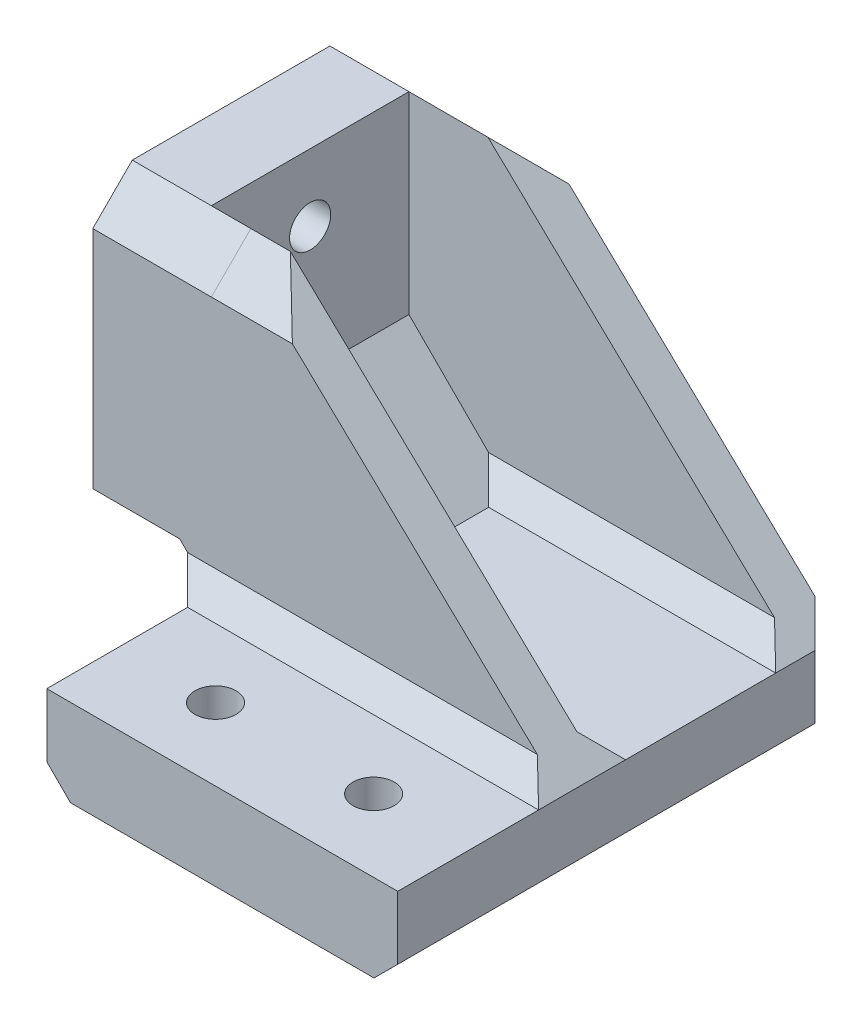
from build123d import *

# Parameters (mm, degrees)
SKETCH2_W                = 44.4
SKETCH2_H                = 55.82
BOSS_EXTRUDE1_DEPTH      = 11
CHAMFER1_SIZE            = 3
SKETCH3_R                = 2.6
CUT_EXTRUDE1_DEPTH       = 62.071371362
SKETCH4_W                = 35
SKETCH4_H                = 37.5
SKETCH4_R                = 2.6
BOSS_EXTRUDE2_DEPTH      = 5
BOSS_EXTRUDE7_DEPTH      = 5
BOSS_EXTRUDE9_DEPTH      = 5
CHAMFER8_SIZE            = 5
BOSS_EXTRUDE11_OUTLINE_W = 35
BOSS_EXTRUDE11_OUTLINE_H = 33.5
BOSS_EXTRUDE11_OUTLINE_R = 2.6
BOSS_EXTRUDE11_DEPTH     = 15
CHAMFER10_SIZE           = 5
SKETCH13_W               = 25
SKETCH13_H               = 34.5
CUT_EXTRUDE2_DEPTH       = 10
BOSS_EXTRUDE12_REACH     = 72.435
BOSS_EXTRUDE13_DEPTH     = 25
CHAMFER11_SIZE           = 3


# Read off the part's stored shape, not the designer's step: Boss-Extrude11
# Some blends are built 0.0001 mm under size
with BuildPart() as part:
    # Sketch2 → Boss-Extrude1 (new body)
    with BuildSketch(Plane(origin=(0, 0, 0), x_dir=(1, 0, 0), z_dir=(0, 1, 0))):
        with Locations((0, 27.91)):
            Rectangle(SKETCH2_W, SKETCH2_H)
    extrude(amount=BOSS_EXTRUDE1_DEPTH)

    # Chamfer1
    chamfer1_edges = [part.edges().sort_by_distance(p)[0] for p in [
        (22.2, 0, -27.91),
        (-22.2, 0, -27.91),
    ]]
    chamfer(chamfer1_edges, length=CHAMFER1_SIZE)

    # Sketch3 → Cut-Extrude1 (cut, through all)
    with BuildSketch(Plane(origin=(0, 11, 0), x_dir=(1, 0, 0), z_dir=(0, 1, 0))):
        with Locations(Location((10, 9.15, 0), (0, 0, 270))):
            Circle(SKETCH3_R)
        with Locations(Location((-10, 9.15, 0), (0, 0, 270))):
            Circle(SKETCH3_R)
    extrude(amount=-CUT_EXTRUDE1_DEPTH, mode=Mode.SUBTRACT)

    # Sketch4 → Boss-Extrude2 (add)
    with BuildSketch(Plane.ZY.offset(22.2)):
        with Locations((-38.32, 29.75)):
            Rectangle(SKETCH4_W, SKETCH4_H)
        with Locations((-38.32, 40)):
            Circle(SKETCH4_R, mode=Mode.SUBTRACT)
    extrude(amount=-BOSS_EXTRUDE2_DEPTH)

    # Sketch8 → Boss-Extrude7 (add)
    with BuildSketch(Plane(origin=(0, 0, -55.82), x_dir=(-1, 0, 0), z_dir=(0, 0, -1))):
        Polygon((-22.2, 11), (22.2, 11), (22.2, 48.5), (17.2, 48.5), align=None)
    extrude(amount=-BOSS_EXTRUDE7_DEPTH)

    # Sketch9 → Boss-Extrude9 (add)
    with BuildSketch(Plane.XY.offset(-20.82)):
        Polygon((-22.2, 11), (-22.2, 48.5), (-17.2, 48.5), (22.2, 11), align=None)
    extrude(amount=-BOSS_EXTRUDE9_DEPTH)

    # Chamfer8
    chamfer8_edges = [part.edges().sort_by_distance(p)[0] for p in [
        (-19.7, 48.5, -20.82),
        (-19.7, 48.5, -55.82),
    ]]
    chamfer(chamfer8_edges, length=CHAMFER8_SIZE)

    # Boss-Extrude11 outline → Boss-Extrude11 (add)
    with BuildSketch(Plane.ZY.offset(22.2)):
        with Locations((-38.32, 31.75)):
            Rectangle(BOSS_EXTRUDE11_OUTLINE_W, BOSS_EXTRUDE11_OUTLINE_H)
        with Locations((-38.32, 40)):
            Circle(BOSS_EXTRUDE11_OUTLINE_R, mode=Mode.SUBTRACT)
    extrude(amount=BOSS_EXTRUDE11_DEPTH)

    # Chamfer10
    chamfer10_edges = [part.edges().sort_by_distance(p)[0] for p in [
        (-29.7, 48.5, -20.82),
        (-29.7, 48.5, -55.82),
    ]]
    chamfer(chamfer10_edges, length=CHAMFER10_SIZE - 0.0001)  # a hair under: the kernel refuses the full size

    # Sketch13 → Cut-Extrude2 (cut)
    with BuildSketch(Plane(origin=(-17.2, 0, 0), x_dir=(0, 0, -1), z_dir=(1, 0, 0))):
        with Locations((38.32, 31.25)):
            Rectangle(SKETCH13_W, SKETCH13_H)
    extrude(amount=-CUT_EXTRUDE2_DEPTH, mode=Mode.SUBTRACT)

    # Boss-Extrude12: up to this face of the body (flat: up to its plane)
    boss_extrude12_end = Plane(part.part.faces().sort_by_distance((-10.417387127, 20.265645238, -55.82))[0])
    # Sketch14 → Boss-Extrude12 (add, up to the picked face)
    with BuildSketch(Plane.XY.offset(-20.82), mode=Mode.PRIVATE) as boss_extrude12_sk1:
        Polygon((-22.2, 15), (-26.2, 15), (-22.2, 11), align=None)
    boss_extrude12_tool1 = split(extrude(boss_extrude12_sk1.sketch, amount=-BOSS_EXTRUDE12_REACH, mode=Mode.PRIVATE), bisect_by=boss_extrude12_end, keep=Keep.BOTH, mode=Mode.PRIVATE)
    add(boss_extrude12_tool1.solids().sort_by(Axis((-23.533333, 13.666667, -20.82), (0, 0, -1)))[0])

    # Sketch15 → Boss-Extrude13 (add)
    with BuildSketch(Plane(origin=(0, 0, -25.82), x_dir=(-1, 0, 0), z_dir=(0, 0, -1))):
        Polygon((14.118524548, 11), (27.2, 24.081475452), (27.2, 15), (22.2, 15), (22.2, 11), align=None)
    extrude(amount=BOSS_EXTRUDE13_DEPTH)

    # Chamfer11
    # the kernel refuses this chamfer: 3 mm, written as the material it adds along each edge
    with BuildSketch(Plane(origin=(22.2, 11, -50.82), x_dir=(0, 0.9996219169112968, -0.027495876610589085), z_dir=(-1, 0, 0))) as chamfer11_piece_1_section:
        Polygon((CHAMFER11_SIZE * 0.999621916911, -CHAMFER11_SIZE * 0.0274958766106), (-CHAMFER11_SIZE * 0.0274958766106, -CHAMFER11_SIZE * 0.999621916911), (0, 0), align=None)
    chamfer11_piece_1 = extrude(amount=44.033573512, mode=Mode.PRIVATE)
    chamfer11_piece_1 = split(chamfer11_piece_1, bisect_by=Plane(origin=(11.645849557, 21.045193949, -49.830255653), z_dir=(-0.689425602489498, -0.7243564996822992, 0)), keep=Keep.TOP, mode=Mode.PRIVATE)
    add(chamfer11_piece_1)
    with BuildSketch(Plane(origin=(22.2, 11, -25.82), x_dir=(0, -0.027495876610589064, -0.9996219169112965), z_dir=(-1, 0, 0))) as chamfer11_piece_2_section:
        Polygon((CHAMFER11_SIZE * 0.999621916911, -CHAMFER11_SIZE * 0.0274958766106), (-CHAMFER11_SIZE * 0.0274958766106, -CHAMFER11_SIZE * 0.999621916911), (0, 0), align=None)
    chamfer11_piece_2 = extrude(amount=44.033573512, mode=Mode.PRIVATE)
    chamfer11_piece_2 = split(chamfer11_piece_2, bisect_by=Plane(origin=(11.645849557, 21.045193949, -26.809744347), z_dir=(-0.6894256024894981, -0.7243564996822992, 0)), keep=Keep.TOP, mode=Mode.PRIVATE)
    add(chamfer11_piece_2)
    with BuildSketch(Plane(origin=(22.2, 11, -20.82), x_dir=(0, 0.9996219169112968, -0.027495876610587933), z_dir=(-1, 0, 0))) as chamfer11_piece_3_section:
        Polygon((CHAMFER11_SIZE * 0.999621916911, -CHAMFER11_SIZE * 0.0274958766106), (-CHAMFER11_SIZE * 0.0274958766106, -CHAMFER11_SIZE * 0.999621916911), (0, 0), align=None)
    chamfer11_piece_3 = extrude(amount=44.4, mode=Mode.PRIVATE)
    chamfer11_piece_3 = split(chamfer11_piece_3, bisect_by=Plane(origin=(9.795664895, 22.806156509, -19.82331844), z_dir=(-0.6894256024894981, -0.7243564996822992, 0)), keep=Keep.TOP, mode=Mode.PRIVATE)
    chamfer11_piece_3 = split(chamfer11_piece_3, bisect_by=Plane(origin=(-11.844103609, 0.644103609, -19.82331844), z_dir=(0.7071067811865474, 0.7071067811865477, 0)), keep=Keep.TOP, mode=Mode.PRIVATE)
    add(chamfer11_piece_3)
    with BuildSketch(Plane(origin=(22.2, 11, -20.82), x_dir=(0, 0.9996219169112968, -0.027495876610587933), z_dir=(-1, 0, 0))) as chamfer11_piece_4_section:
        Polygon((CHAMFER11_SIZE * 0.999621916911, -CHAMFER11_SIZE * 0.0274958766106), (-CHAMFER11_SIZE * 0.0274958766106, -CHAMFER11_SIZE * 0.999621916911), (0, 0), align=None)
    chamfer11_piece_4 = extrude(amount=52.115048964, mode=Mode.PRIVATE)
    chamfer11_piece_4 = split(chamfer11_piece_4, bisect_by=Plane(origin=(-23.372890722, 12.172890722, -20.136626916), z_dir=(0.7071067811865474, 0.7071067811865477, 0)), keep=Keep.TOP, mode=Mode.PRIVATE)
    chamfer11_piece_4 = split(chamfer11_piece_4, bisect_by=Plane(origin=(-22.2, 12.563854296, -20.136626916), z_dir=(-1, 0, 0)), keep=Keep.TOP, mode=Mode.PRIVATE)
    add(chamfer11_piece_4)
    # the kernel refuses this chamfer: 3 mm, written as the material it takes off along each edge
    with BuildSketch(Plane(origin=(-22.2, 18.715048964, -55.82), x_dir=(0.9996219169112965, 0, -0.02749587661058676), z_dir=(0, -1, 0))) as chamfer11_2_piece_1_section:
        Polygon((CHAMFER11_SIZE * 0.999621916911, CHAMFER11_SIZE * 0.0274958766106), (-CHAMFER11_SIZE * 0.0274958766106, CHAMFER11_SIZE * 0.999621916911), (0, 0), align=None)
    chamfer11_2_piece_1 = extrude(amount=23.430097928, mode=Mode.PRIVATE)
    chamfer11_2_piece_1 = split(chamfer11_2_piece_1, bisect_by=Plane(origin=(-17.558310603, 6.358310603, -54.809870411), z_dir=(-0.7071067811865474, -0.7071067811865477, 0)), keep=Keep.TOP, mode=Mode.PRIVATE)
    add(chamfer11_2_piece_1, mode=Mode.SUBTRACT)
    with BuildSketch(Plane(origin=(22.2, -4.715048964, -55.82), x_dir=(-0.9996219169112965, 0, -0.02749587661058676), z_dir=(0, 1, 0))) as chamfer11_2_piece_2:
        Polygon((CHAMFER11_SIZE * 0.999621916911, CHAMFER11_SIZE * 0.0274958766106), (-CHAMFER11_SIZE * 0.0274958766106, CHAMFER11_SIZE * 0.999621916911), (0, 0), align=None)
    extrude(amount=23.430097928, mode=Mode.SUBTRACT)
    with BuildSketch(Plane(origin=(26.915048964, 0, -55.82), x_dir=(0, 0.9996219169112968, -0.027495876610586778), z_dir=(-1, 0, 0))) as chamfer11_2_piece_3:
        Polygon((CHAMFER11_SIZE * 0.999621916911, -CHAMFER11_SIZE * 0.0274958766106), (-CHAMFER11_SIZE * 0.0274958766106, -CHAMFER11_SIZE * 0.999621916911), (0, 0), align=None)
    extrude(amount=53.830097928, mode=Mode.SUBTRACT)


solid = part.part
